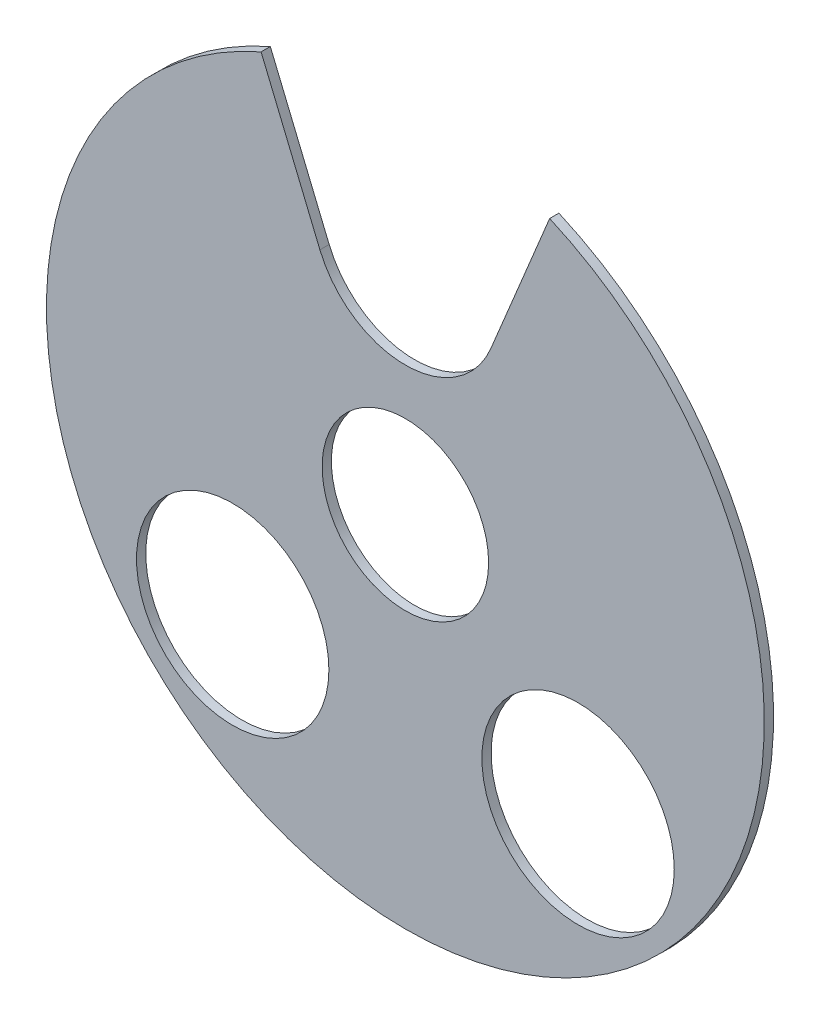
from build123d import *

# Parameters (mm, degrees)
ESQUISSE1_R      = 97
ESQUISSE1_R_2    = 22.5
MAIN_DEPTH       = 2.5
HOLES_DEPTH      = 138.201494161
HOLES_DEPTH_BACK = 138.201494161
ESQUISSE2_R      = 26


with BuildPart() as part:
    # Esquisse1 → Main (new body)
    with BuildSketch(Plane.XY):
        Circle(ESQUISSE1_R)
        Circle(ESQUISSE1_R_2, mode=Mode.SUBTRACT)
    extrude(amount=MAIN_DEPTH)

    # Esquisse2 → Holes (cut, two sides: drawn at the far end of the back side and taken through both)
    with BuildSketch(Plane.XY.offset(2.5).offset(-HOLES_DEPTH_BACK)):
        with Locations((-46.669047558, -46.669047558)):
            Circle(ESQUISSE2_R)
        with Locations((46.669047558, -46.669047558)):
            Circle(ESQUISSE2_R)
        with BuildLine():
            Line((-23.096988313, 50.432914191), (-38.995875853, 88.816224117))
            ThreePointArc((-38.995875853, 88.816224117), (0, 97), (38.995875853, 88.816224117))
            Line((38.995875853, 88.816224117), (23.096988313, 50.432914191))
            ThreePointArc((23.096988313, 50.432914191), (0, 35), (-23.096988313, 50.432914191))
        make_face()
    extrude(amount=HOLES_DEPTH + HOLES_DEPTH_BACK, mode=Mode.SUBTRACT)


solid = part.part
